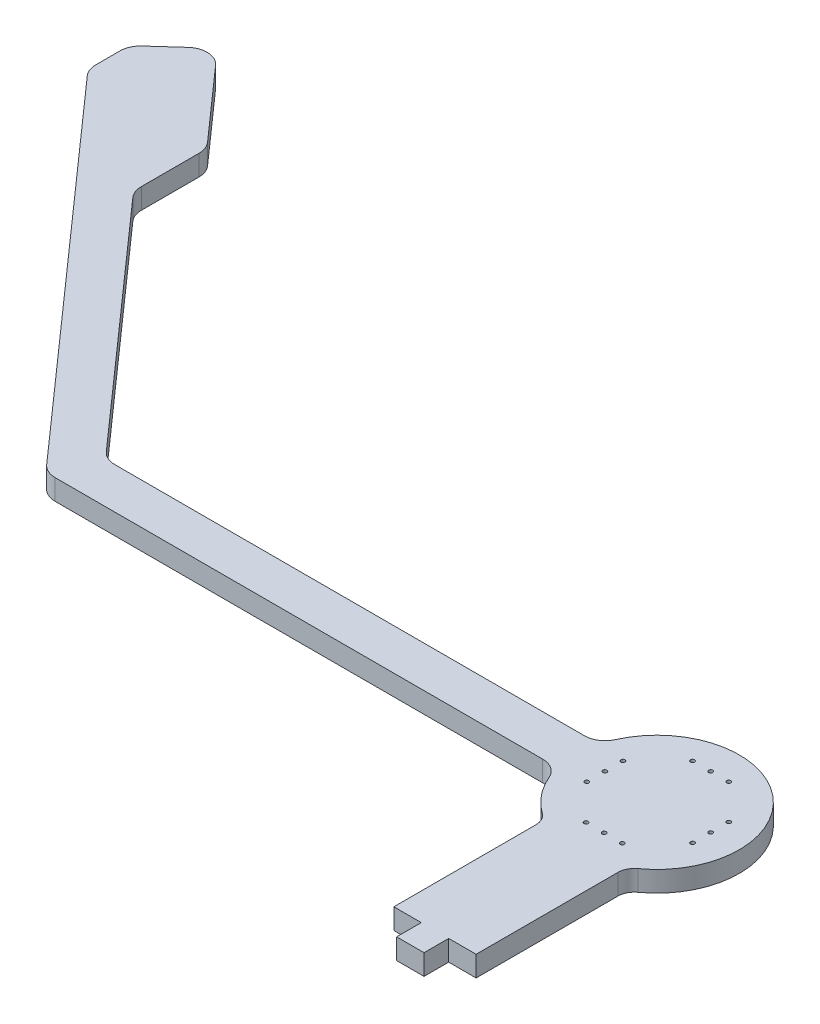
from build123d import *

# Parameters (mm, degrees)
STOCK_RECORD_NEEDLE_1_DEPTH     = 3.175
FILLET1_R                       = 3.175
X_Z_TURN_SKETCH_W               = 4.233333334
X_Z_TURN_SKETCH_H               = 3.81
X_Y_TURN_DEPTH                  = 3.175
FILLET2_R                       = 2.54
RIGHT_START                     = -3.175
RIGHT_SIDE_DELETE_DEPTH         = 3.175
SERVO_HORN_MOUNT_HOLES_SKETCH_R = 0.3175
SERVO_HORN_MOUNT_HOLES_DEPTH    = 157.399949281


# Read off the part's stored shape, not the designer's step: Stock-Record Needle-1
with BuildPart() as part:
    # Stock-Record Needle-1 outline → Stock-Record Needle-1 (new body)
    with BuildSketch(Plane(origin=(0, 0, 0), x_dir=(1, 0, 0), z_dir=(0, 1, 0))):
        with BuildLine():
            Line((-12.264516886, 3.297214818), (-88.464516886, 3.297214818))
            Line((-88.464516886, 3.297214818), (-122.158808708, 41.314772585))
            Line((-122.158808708, 41.314772585), (-122.158808708, 52.642883574))
            Line((-122.158808708, 52.642883574), (-134.794168142, 66.899467737))
            Line((-134.794168142, 66.899467737), (-141.955930631, 60.428744281))
            Line((-141.955930631, 60.428744281), (-141.955930631, 54.078744281))
            Line((-141.955930631, 54.078744281), (-91.321262361, -3.052785182))
            Line((-91.321262361, -3.052785182), (-12.327631672, -3.052785182))
            ThreePointArc((-12.327631672, -3.052785182), (12.699372727, -0.126223338), (-12.264516886, 3.297214818))
        make_face()
    extrude(amount=STOCK_RECORD_NEEDLE_1_DEPTH)

    # Fillet1
    fillet1_edges = [part.edges().sort_by_distance(p)[0] for p in [
        (-122.158808708, 1.5875, -52.642883574),
        (-134.794168142, 1.5875, -66.899467737),
        (-141.955930631, 1.5875, -60.428744281),
        (-141.955930631, 1.5875, -54.078744281),
        (-12.327631672, 1.5875, 3.052785182),
        (-12.264516886, 1.5875, -3.297214818),
        (-88.464516886, 1.5875, -3.297214818),
        (-122.158808708, 1.5875, -41.314772585),
        (-91.321262361, 1.5875, 3.052785182),
    ]]
    fillet(fillet1_edges, radius=FILLET1_R)

    # X-Z Turn Sketch' → X-Y Turn (add)
    with BuildSketch(Plane(origin=(0, 0, 0), x_dir=(1, 0, 0), z_dir=(0, 1, 0))):
        Polygon((-6.35, 34.29), (-2.116666667, 34.29), (-2.116666667, 38.1), (2.116666667, 38.1), (2.116666667, 34.29), (6.35, 34.29), (6.35, -34.29), (2.116666667, -34.29), (-2.116666667, -34.29), (-6.35, -34.29), align=None)
        with Locations((0, -36.195)):
            Rectangle(X_Z_TURN_SKETCH_W, X_Z_TURN_SKETCH_H)
    extrude(amount=X_Y_TURN_DEPTH)

    # Fillet2
    fillet2_edges = [part.edges().sort_by_distance(p)[0] for p in [
        (6.35, 1.5875, -10.998522627),
        (6.35, 1.5875, 10.998522628),
        (-6.35, 1.5875, -10.998522628),
        (-6.35, 1.5875, 10.998522629),
    ]]
    fillet(fillet2_edges, radius=FILLET2_R)

    # Sketch2 → Right Side Delete (cut)
    with BuildSketch(Plane(origin=(0, 3.175, 0), x_dir=(1, 0, 0), z_dir=(0, 1, 0)).offset(RIGHT_START)):
        with BuildLine():
            Line((11.695597813, 4.950049677), (11.695597813, 35.504326251))
            Line((11.695597813, 35.504326251), (11.695597813, 40.086272904))
            Line((11.695597813, 40.086272904), (-12.040083059, 40.086272904))
            Line((-12.040083059, 40.086272904), (-9.843545264, 8.024625639))
            ThreePointArc((-9.843545264, 8.024625639), (1.79465289, 12.572558252), (11.695597813, 4.950049677))
        make_face()
    extrude(amount=RIGHT_SIDE_DELETE_DEPTH, mode=Mode.SUBTRACT)

    # Servo Horn Mount Holes Sketch → Servo Horn Mount Holes (cut, through all)
    with BuildSketch(Plane.XZ):
        with Locations(Location((0, 8.1661, 0), (0, 0, 270))):
            Circle(SERVO_HORN_MOUNT_HOLES_SKETCH_R)
        with Locations(Location((2.794, 8.1661, 0), (0, 0, 270))):
            Circle(SERVO_HORN_MOUNT_HOLES_SKETCH_R)
        with Locations(Location((-2.794, 8.1661, 0), (0, 0, 270))):
            Circle(SERVO_HORN_MOUNT_HOLES_SKETCH_R)
        with Locations(Location((2.794, -8.279792428, 0), (0, 0, 90))):
            Circle(SERVO_HORN_MOUNT_HOLES_SKETCH_R)
        with Locations(Location((0, -8.279792428, 0), (0, 0, 90))):
            Circle(SERVO_HORN_MOUNT_HOLES_SKETCH_R)
        with Locations(Location((-2.794, -8.279792428, 0), (0, 0, 90))):
            Circle(SERVO_HORN_MOUNT_HOLES_SKETCH_R)
        with Locations(Location((8.1661, -0.113692428, 0), (0, 0, 270))):
            Circle(SERVO_HORN_MOUNT_HOLES_SKETCH_R)
        with Locations(Location((8.1661, 2.680307572, 0), (0, 0, 270))):
            Circle(SERVO_HORN_MOUNT_HOLES_SKETCH_R)
        with Locations(Location((8.1661, -2.907692428, 0), (0, 0, 270))):
            Circle(SERVO_HORN_MOUNT_HOLES_SKETCH_R)
        with Locations(Location((-8.1661, -2.907692428, 0), (0, 0, 90))):
            Circle(SERVO_HORN_MOUNT_HOLES_SKETCH_R)
        with Locations(Location((-8.1661, 2.680307572, 0), (0, 0, 90))):
            Circle(SERVO_HORN_MOUNT_HOLES_SKETCH_R)
        with Locations(Location((-8.1661, -0.113692428, 0), (0, 0, 90))):
            Circle(SERVO_HORN_MOUNT_HOLES_SKETCH_R)
    extrude(amount=-SERVO_HORN_MOUNT_HOLES_DEPTH, mode=Mode.SUBTRACT)


solid = part.part
